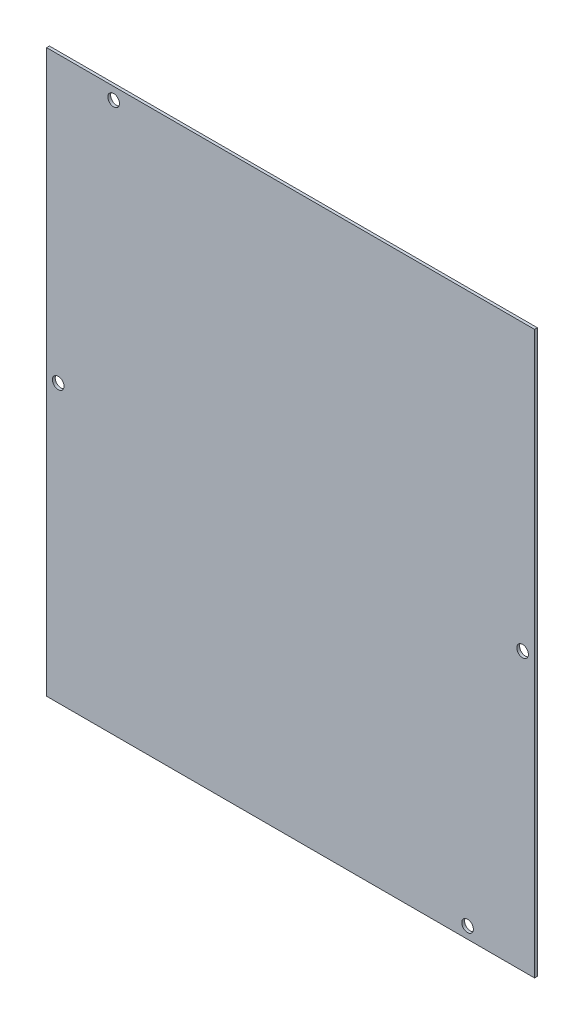
from build123d import *

# Parameters (mm, degrees)
CROQUIS1_W            = 330.962
CROQUIS1_H            = 381
BRIDA_BASE1_DEPTH     = 1.905
CROQUIS6_R            = 3.937
CORTAR_EXTRUIR1_DEPTH = 253.34468567


# Sheet-metal steps are written as plain solids
with BuildPart() as part:
    # Croquis1 → Brida base1 (new body)
    with BuildSketch(Plane.XY):
        Rectangle(CROQUIS1_W, CROQUIS1_H)
    extrude(amount=-BRIDA_BASE1_DEPTH)

    # Croquis6 → Cortar-Extruir1 (cut, through all)
    with BuildSketch(Plane.XY):
        with Locations((-120.015, 182.372)):
            Circle(CROQUIS6_R)
        with Locations((-157.607, -2.54)):
            Circle(CROQUIS6_R)
        with Locations((157.353, -2.54)):
            Circle(CROQUIS6_R)
        with Locations((120.015, -182.626)):
            Circle(CROQUIS6_R)
    extrude(amount=-CORTAR_EXTRUIR1_DEPTH, mode=Mode.SUBTRACT)


solid = part.part
